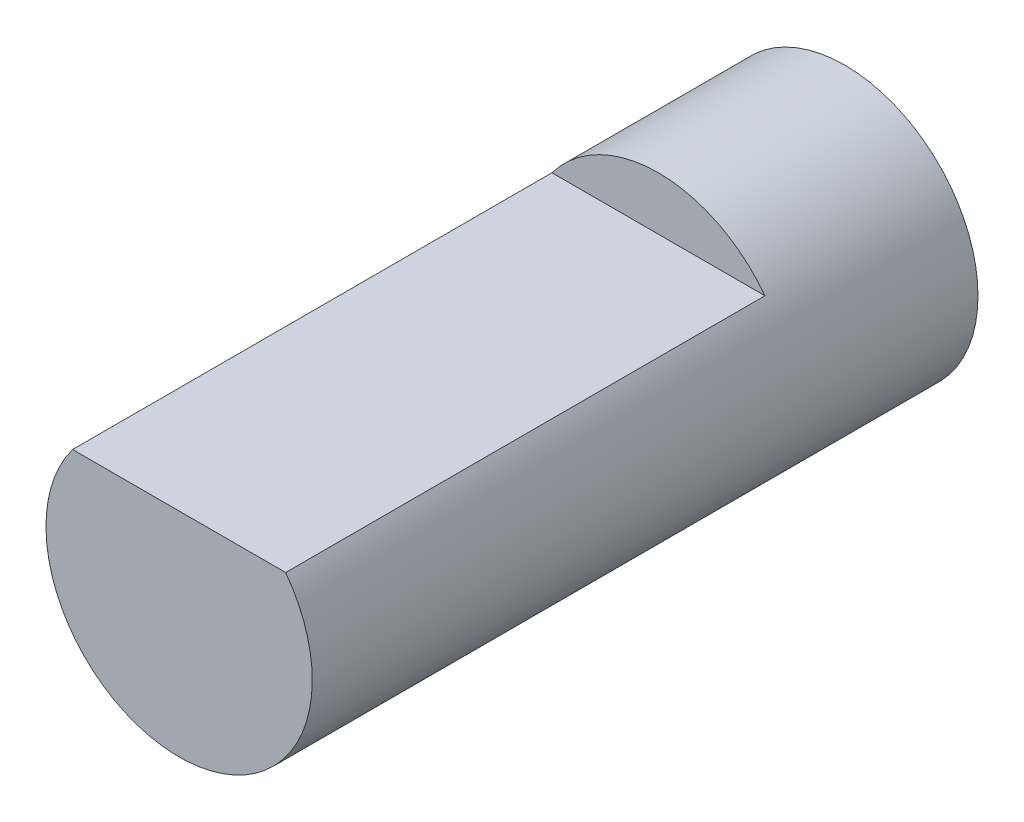
from build123d import *
from build123d.topology import SkipClean

# Parameters (mm, degrees)
SKETCH1_R           = 2.5
BOSS_EXTRUDE2_DEPTH = 3.5
BOSS_EXTRUDE3_DEPTH = 9


with BuildPart() as part:
    # Sketch1 → Boss-Extrude2 (new body)
    with BuildSketch(Plane.XY):
        Circle(SKETCH1_R)
    extrude(amount=BOSS_EXTRUDE2_DEPTH)

    # Sketch3 → Boss-Extrude3 (add)
    with SkipClean():  # the faces are left unmerged after this step: merging them gives an invalid solid
        with BuildSketch(Plane.XY.offset(3.5)):
            with BuildLine():
                Line((-2, 1.5), (2, 1.5))
                ThreePointArc((2, 1.5), (0, -2.5), (-2, 1.5))
            make_face()
        extrude(amount=BOSS_EXTRUDE3_DEPTH)
    add(part.part.scale(1), mode=Mode.REPLACE)  # the faces are merged on a copy


solid = part.part
